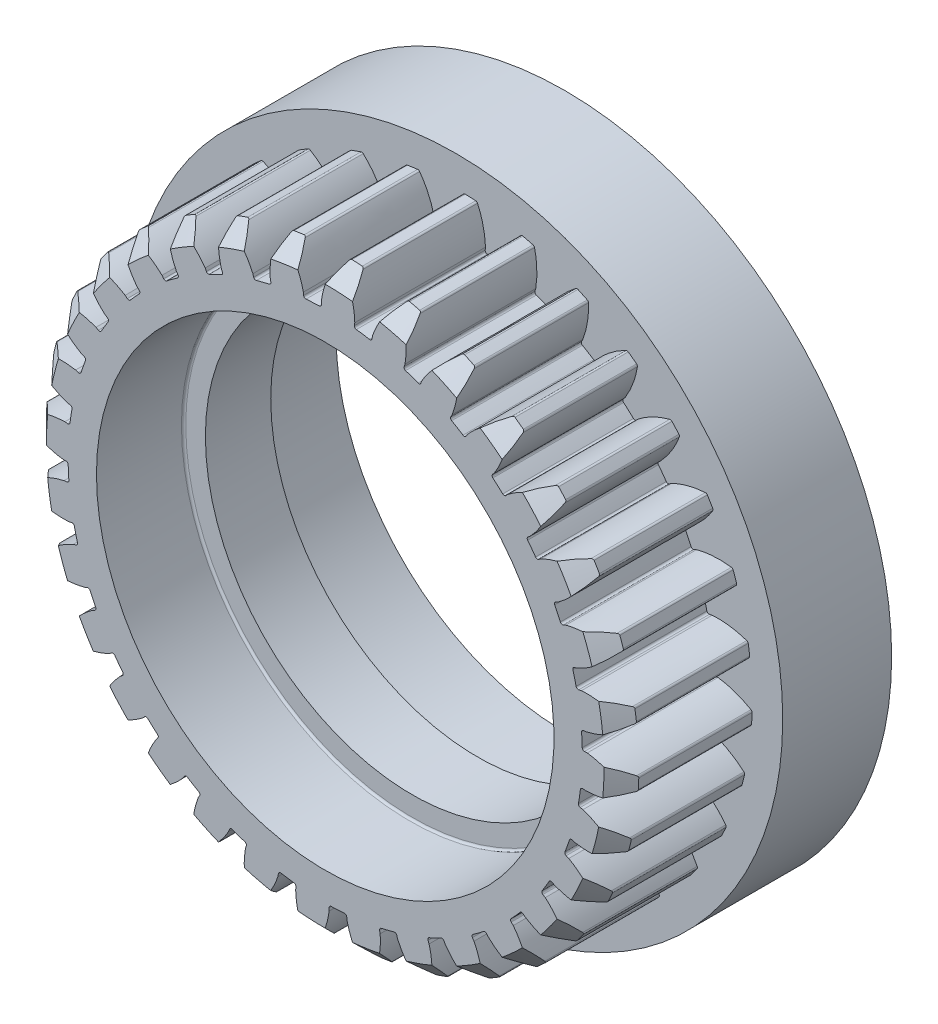
from build123d import *

# Parameters (mm, degrees)
FILLET_2_R                       = 0.1
EXTRUDE_1_REACH                  = 25.043
EXTRUDE_1_DIRECTION_2_REACH      = 25.043
FILLET_3_R                       = 0.1
PATTERN_CIRCULAR_1_COUNT         = 32
FILLET_3_OF_PATTERN_CIRCULAR_1_R = 0.1


with BuildPart() as part:
    # Эскиз18 → Повернуть1 (revolve)
    with BuildSketch(Plane(origin=(0, 0, 0), x_dir=(0, 0, -1), z_dir=(1, 0, 0))):
        Polygon((-5.5, -10.5), (-1.5, -10.5), (-1.5, -9.5), (1.5, -9.5), (1.5, -10.5), (5.5, -10.5), (5.5, -15), (0.5, -15), (0.5, -11.8), (-5.5, -11.8), align=None)
    revolve(axis=Axis((0, 0, 0), (0, 0, 1)))

    # Скругление2
    fillet_2_edges = [part.edges().sort_by_distance(p)[0] for p in [
        (0, 10.5, 1.5),
        (0, 10.5, -1.5),
    ]]
    fillet(fillet_2_edges, radius=FILLET_2_R)

    # Бобышка-Вытянуть1: up to this face of the body (flat: up to its plane)
    extrude_1_end = Plane(part.part.faces().sort_by_distance((0, 11.466245599, 5.5))[0])
    # Эскиз19 → Бобышка-Вытянуть1 (add, up to the picked face)
    with BuildSketch(Plane.XY.offset(3.5), mode=Mode.PRIVATE) as extrude_1_sk1:
        with BuildLine():
            Line((-0.179264269, 12.02672961), (-0.175865218, 11.798689394))
            ThreePointArc((-0.175865218, 11.798689394), (0.578998557, 11.785786383), (1.331492173, 11.724637674))
            Line((1.331492173, 11.724637674), (1.357226706, 11.951246648))
            add(Edge.make_bspline(
                [(1.357226706, 11.951246648), (1.329458515, 12.798710581), (0.964008421, 13.565791085)],
                knots=[0, 0, 0, 1, 1, 1], degree=2))
            ThreePointArc((0.964008421, 13.565791085), (0.667320371, 13.583618204), (0.370313592, 13.594957442))
            add(Edge.make_bspline(
                [(-0.179264269, 12.02672961), (-0.068563798, 12.867391013), (0.370313592, 13.594957442)],
                knots=[0, 0, 0, 1, 1, 1], degree=2))
        make_face()
    extrude_1_tool1 = split(extrude(extrude_1_sk1.sketch, amount=EXTRUDE_1_REACH, mode=Mode.PRIVATE), bisect_by=extrude_1_end, keep=Keep.BOTH, mode=Mode.PRIVATE)
    extrude_1 = extrude_1_tool1.solids().sort_by(Axis((0.617266, 12.564748, 3.5), (0, 0, 1)))[0]
    add(extrude_1)

    # Бобышка-Вытянуть1 direction 2: up to this face of the body (flat: up to its plane)
    extrude_1_direction_2_end = Plane(part.part.faces().sort_by_distance((0, 14.575735931, -0.5))[0])
    # Эскиз19 → Бобышка-Вытянуть1 direction 2 (add, up to the picked face)
    with BuildSketch(Plane.XY.offset(3.5), mode=Mode.PRIVATE) as extrude_1_direction_2_sk1:
        with BuildLine():
            Line((-0.179264269, 12.02672961), (-0.175865218, 11.798689394))
            ThreePointArc((-0.175865218, 11.798689394), (0.578998557, 11.785786383), (1.331492173, 11.724637674))
            Line((1.331492173, 11.724637674), (1.357226706, 11.951246648))
            add(Edge.make_bspline(
                [(1.357226706, 11.951246648), (1.329458515, 12.798710581), (0.964008421, 13.565791085)],
                knots=[0, 0, 0, 1, 1, 1], degree=2))
            ThreePointArc((0.964008421, 13.565791085), (0.667320371, 13.583618204), (0.370313592, 13.594957442))
            add(Edge.make_bspline(
                [(-0.179264269, 12.02672961), (-0.068563798, 12.867391013), (0.370313592, 13.594957442)],
                knots=[0, 0, 0, 1, 1, 1], degree=2))
        make_face()
    extrude_1_direction_2_tool1 = split(extrude(extrude_1_direction_2_sk1.sketch, amount=-EXTRUDE_1_DIRECTION_2_REACH, mode=Mode.PRIVATE), bisect_by=extrude_1_direction_2_end, keep=Keep.BOTH, mode=Mode.PRIVATE)
    extrude_1_direction_2 = extrude_1_direction_2_tool1.solids().sort_by(Axis((0.617266, 12.564748, 3.5), (0, 0, -1)))[0]
    add(extrude_1_direction_2)

    # Скругление3
    fillet_3_edges = [part.edges().sort_by_distance(p)[0] for p in [
        (-0.175865218, 11.798689394, 2.5),
        (1.331492173, 11.724637674, 2.5),
        (0.964008421, 13.565791085, 1.5),
        (0.370313592, 13.594957442, 1.5),
    ]]
    fillet(fillet_3_edges, radius=FILLET_3_R)

    # Круговой массив1: Бобышка-Вытянуть1, Бобышка-Вытянуть1 direction 2 ×32 about axis
    pattern_circular_1_axis = Axis((0, 0, 0), (0, 0, -1))
    add([extrude_1.rotate(pattern_circular_1_axis, i * 360 / PATTERN_CIRCULAR_1_COUNT) for i in range(1, PATTERN_CIRCULAR_1_COUNT)])
    add([extrude_1_direction_2.rotate(pattern_circular_1_axis, i * 360 / PATTERN_CIRCULAR_1_COUNT) for i in range(1, PATTERN_CIRCULAR_1_COUNT)])

    # Скругление3 of Круговой массив1
    fillet_3_of_pattern_circular_1_edges = [part.edges().sort_by_distance(p)[0] for p in [
        (2.129324096, 11.606290488, 2.5),
        (3.593271264, 11.239590812, 2.5),
        (3.59203982, 13.1170595, 1.5),
        (3.015442745, 13.261489549, 1.5),
        (4.352684679, 10.967868347, 2.5),
        (5.716962955, 10.322612778, 2.5),
        (6.082031144, 12.164246675, 1.5),
        (5.544690125, 12.418390049, 1.5),
        (6.408774031, 9.907957177, 2.5),
        (7.620954966, 9.008942524, 2.5),
        (8.338293422, 10.743968671, 1.5),
        (7.860858172, 11.098058785, 1.5),
        (8.218577791, 8.467288768, 2.5),
        (9.232077951, 7.349063662, 2.5),
        (10.27411976, 8.910805977, 1.5),
        (9.874937849, 9.351235345, 1.5),
        (9.712546216, 6.701227201, 2.5),
        (10.488417358, 5.406764404, 2.5),
        (11.815117437, 6.735206006, 1.5),
        (11.509529202, 7.245049175, 1.5),
        (10.833266937, 4.677641231, 2.5),
        (11.341692768, 3.256686222, 2.5),
        (12.902066777, 4.300775846, 1.5),
        (12.701815802, 4.860439829, 1.5),
        (11.537671284, 2.474296131, 2.5),
        (11.759113286, 0.981455415, 2.5),
        (13.493196927, 1.701069282, 1.5),
        (13.405978744, 2.289046505, 1.5),
        (11.798689394, 0.175865218, 2.5),
        (11.724637674, -1.331492173, 2.5),
        (13.565791085, -0.964008421, 1.5),
        (13.594957442, -0.370313592, 1.5),
        (11.606290488, -2.129324096, 2.5),
        (11.239590812, -3.593271264, 2.5),
        (13.1170595, -3.59203982, 1.5),
        (13.261489549, -3.015442745, 1.5),
        (10.967868347, -4.352684679, 2.5),
        (10.322612778, -5.716962955, 2.5),
        (12.164246675, -6.082031144, 1.5),
        (12.418390049, -5.544690125, 1.5),
        (9.907957177, -6.408774031, 2.5),
        (9.008942524, -7.620954966, 2.5),
        (10.743968671, -8.338293422, 1.5),
        (11.098058785, -7.860858172, 1.5),
        (8.467288768, -8.218577791, 2.5),
        (7.349063662, -9.232077951, 2.5),
        (8.910805977, -10.27411976, 1.5),
        (9.351235345, -9.874937849, 1.5),
        (6.701227201, -9.712546216, 2.5),
        (5.406764404, -10.488417358, 2.5),
        (6.735206006, -11.815117437, 1.5),
        (7.245049175, -11.509529202, 1.5),
        (4.677641231, -10.833266937, 2.5),
        (3.256686222, -11.341692768, 2.5),
        (4.300775846, -12.902066777, 1.5),
        (4.860439829, -12.701815802, 1.5),
        (2.474296131, -11.537671284, 2.5),
        (0.981455415, -11.759113286, 2.5),
        (1.701069282, -13.493196927, 1.5),
        (2.289046505, -13.405978744, 1.5),
        (0.175865218, -11.798689394, 2.5),
        (-1.331492173, -11.724637674, 2.5),
        (-0.964008421, -13.565791085, 1.5),
        (-0.370313592, -13.594957442, 1.5),
        (-2.129324096, -11.606290488, 2.5),
        (-3.593271264, -11.239590812, 2.5),
        (-3.59203982, -13.1170595, 1.5),
        (-3.015442745, -13.261489549, 1.5),
        (-4.352684679, -10.967868347, 2.5),
        (-5.716962955, -10.322612778, 2.5),
        (-6.082031144, -12.164246675, 1.5),
        (-5.544690125, -12.418390049, 1.5),
        (-6.408774031, -9.907957177, 2.5),
        (-7.620954966, -9.008942524, 2.5),
        (-8.338293422, -10.743968671, 1.5),
        (-7.860858172, -11.098058785, 1.5),
        (-8.218577791, -8.467288768, 2.5),
        (-9.232077951, -7.349063662, 2.5),
        (-10.27411976, -8.910805977, 1.5),
        (-9.874937849, -9.351235345, 1.5),
        (-9.712546216, -6.701227201, 2.5),
        (-10.488417358, -5.406764404, 2.5),
        (-11.815117437, -6.735206006, 1.5),
        (-11.509529202, -7.245049175, 1.5),
        (-10.833266937, -4.677641231, 2.5),
        (-11.341692768, -3.256686222, 2.5),
        (-12.902066777, -4.300775846, 1.5),
        (-12.701815802, -4.860439829, 1.5),
        (-11.537671284, -2.474296131, 2.5),
        (-11.759113286, -0.981455415, 2.5),
        (-13.493196927, -1.701069282, 1.5),
        (-13.405978744, -2.289046505, 1.5),
        (-11.798689394, -0.175865218, 2.5),
        (-11.724637674, 1.331492173, 2.5),
        (-13.565791085, 0.964008421, 1.5),
        (-13.594957442, 0.370313592, 1.5),
        (-11.606290488, 2.129324096, 2.5),
        (-11.239590812, 3.593271264, 2.5),
        (-13.1170595, 3.59203982, 1.5),
        (-13.261489549, 3.015442745, 1.5),
        (-10.967868347, 4.352684679, 2.5),
        (-10.322612778, 5.716962955, 2.5),
        (-12.164246675, 6.082031144, 1.5),
        (-12.418390049, 5.544690125, 1.5),
        (-9.907957177, 6.408774031, 2.5),
        (-9.008942524, 7.620954966, 2.5),
        (-10.743968671, 8.338293422, 1.5),
        (-11.098058785, 7.860858172, 1.5),
        (-8.467288768, 8.218577791, 2.5),
        (-7.349063662, 9.232077951, 2.5),
        (-8.910805977, 10.27411976, 1.5),
        (-9.351235345, 9.874937849, 1.5),
        (-6.701227201, 9.712546216, 2.5),
        (-5.406764404, 10.488417358, 2.5),
        (-6.735206006, 11.815117437, 1.5),
        (-7.245049175, 11.509529202, 1.5),
        (-4.677641231, 10.833266937, 2.5),
        (-3.256686222, 11.341692768, 2.5),
        (-4.300775846, 12.902066777, 1.5),
        (-4.860439829, 12.701815802, 1.5),
        (-2.474296131, 11.537671284, 2.5),
        (-0.981455415, 11.759113286, 2.5),
        (-1.701069282, 13.493196927, 1.5),
        (-2.289046505, 13.405978744, 1.5),
    ]]
    fillet(fillet_3_of_pattern_circular_1_edges, radius=FILLET_3_OF_PATTERN_CIRCULAR_1_R)

    # Эскиз21 → Вырез-Повернуть1 (revolve, cut)
    with BuildSketch(Plane(origin=(0, 0, 0), x_dir=(0, 0, -1), z_dir=(1, 0, 0))):
        Polygon((-5.5, 12.8), (-5.5, 13.6), (-4.7, 13.6), align=None)
    revolve(axis=Axis((0, 0, 0), (0, 0, -1)), mode=Mode.SUBTRACT)


solid = part.part
